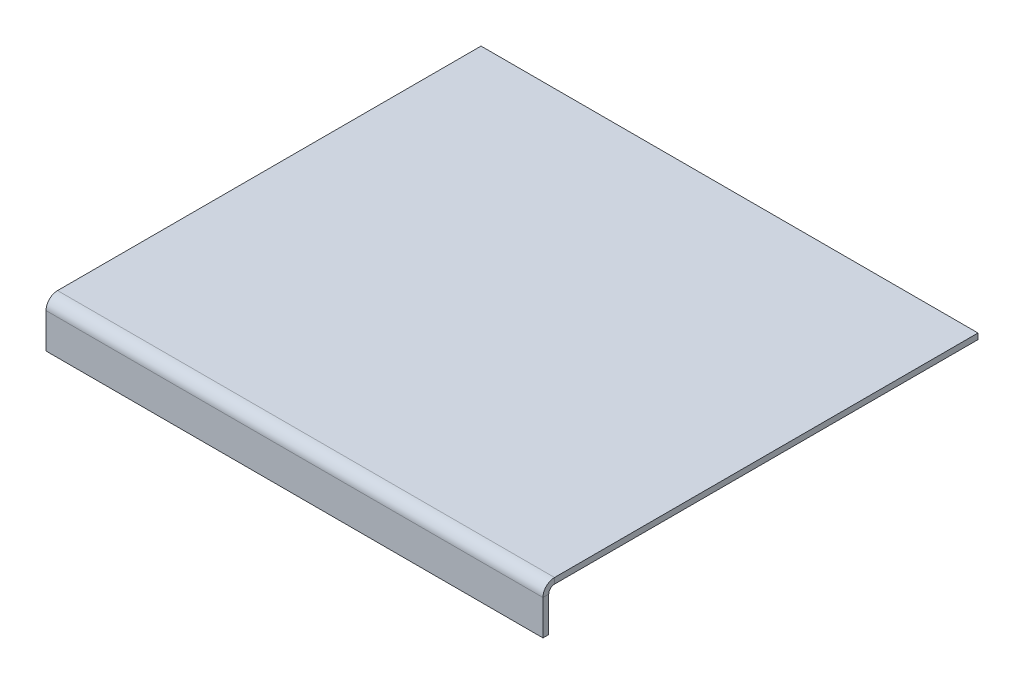
from build123d import *

# Parameters (mm, degrees)
SKETCH1_W                    = 203.2
SKETCH1_H                    = 175.514
BASE_FLANGE1_DEPTH           = 2.3622
EDGE_FLANGE4_STRIP_W         = 14.1688
EDGE_FLANGE4_STRIP_H         = 2.3622
EDGE_FLANGE4_STRIP_CUT_DEPTH = 203.2
EDGE_FLANGE4_DEPTH           = 203.2


# Sheet-metal steps are written as plain solids
with BuildPart() as part:
    # Sketch1 → Base-Flange1 (new body)
    with BuildSketch(Plane(origin=(0, 0, 0), x_dir=(1, 0, 0), z_dir=(0, 1, 0))):
        Rectangle(SKETCH1_W, SKETCH1_H)
    extrude(amount=-BASE_FLANGE1_DEPTH)

    # Edge-Flange4 strip (across the edge) → Edge-Flange4 strip cut (cut)
    with BuildSketch(Plane(origin=(101.6, -2.3622, 87.757), x_dir=(0, 0, -1), z_dir=(-1, 0, 0))):
        with Locations((-4.7244, -1.1811)):
            Rectangle(EDGE_FLANGE4_STRIP_W, EDGE_FLANGE4_STRIP_H)
    extrude(amount=EDGE_FLANGE4_STRIP_CUT_DEPTH, mode=Mode.SUBTRACT)

    # Edge-Flange4 section (across the edge) → Edge-Flange4 (add)
    with BuildSketch(Plane(origin=(101.6, -2.3622, 87.757), x_dir=(0, 0, -1), z_dir=(-1, 0, 0))):
        with BuildLine():
            Line((-2.3622, 2.36), (-2.3622, 16.6878))
            Line((-2.3622, 16.6878), (0, 16.6878))
            Line((0, 16.6878), (0, 2.36))
            ThreePointArc((0, 2.36), (0.691227996, 0.691227996), (2.36, 0))
            Line((2.36, 0), (2.36, -2.3622))
            ThreePointArc((2.36, -2.3622), (-0.979099642, -0.979099642), (-2.3622, 2.36))
        make_face()
    extrude(amount=EDGE_FLANGE4_DEPTH)


solid = part.part
